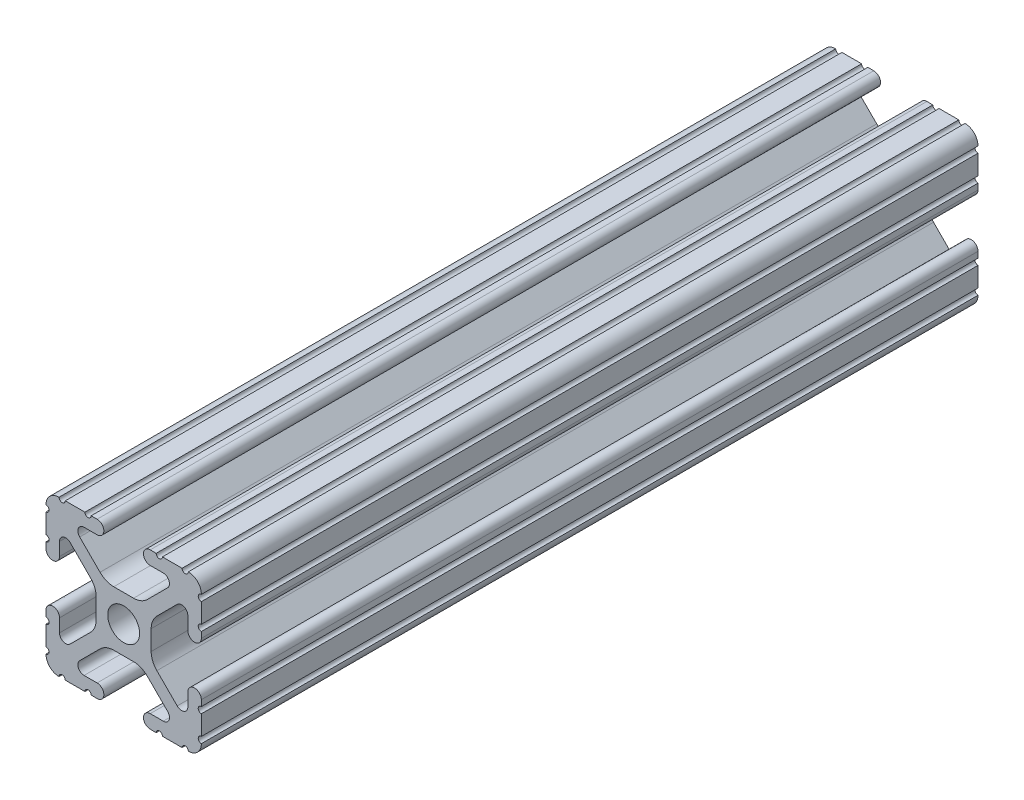
from build123d import *

# Parameters (mm, degrees)
SKETCH1_R           = 2.6035
BOSS_EXTRUDE1_DEPTH = 127


with BuildPart() as part:
    # Sketch1 → Boss-Extrude1 (new body)
    with BuildSketch(Plane.XY):
        with BuildLine():
            Line((-12.7, -6.3330836), (-12.7, -9.5504))
            ThreePointArc((-12.7, -9.5504), (-12.192000006, -10.058323491), (-12.699846982, -10.566399977))
            ThreePointArc((-12.699846982, -10.566399977), (-12.082522516, -12.082522516), (-10.566399977, -12.699846982))
            ThreePointArc((-10.566399977, -12.699846982), (-10.058323491, -12.192000006), (-9.5504, -12.7))
            Line((-9.5504, -12.7), (-6.3330836, -12.7))
            ThreePointArc((-6.3330836, -12.7), (-5.8250836, -12.192), (-5.3170836, -12.7))
            Line((-5.3170836, -12.7), (-4.343399971, -12.7))
            ThreePointArc((-4.343399971, -12.7), (-3.238499971, -11.5951), (-4.343399971, -10.4902))
            Line((-4.343399971, -10.4902), (-6.474794456, -10.4902))
            ThreePointArc((-6.474794456, -10.4902), (-7.413456061, -9.863006367), (-7.193214945, -8.75577951))
            Line((-7.193214945, -8.75577951), (-3.863171405, -5.42573597))
            ThreePointArc((-3.863171405, -5.42573597), (-2.833127272, -4.737482484), (-1.618107374, -4.4958))
            Line((-1.618107374, -4.4958), (1.618107374, -4.4958))
            ThreePointArc((1.618107374, -4.4958), (2.833127272, -4.737482484), (3.863171405, -5.42573597))
            Line((3.863171405, -5.42573597), (7.193214945, -8.75577951))
            ThreePointArc((7.193214945, -8.75577951), (7.413456061, -9.863006367), (6.474794456, -10.4902))
            Line((6.474794456, -10.4902), (4.3434, -10.4902))
            ThreePointArc((4.3434, -10.4902), (3.2385, -11.5951), (4.3434, -12.7))
            Line((4.3434, -12.7), (5.3170836, -12.7))
            ThreePointArc((5.3170836, -12.7), (5.8250836, -12.192), (6.3330836, -12.7))
            Line((6.3330836, -12.7), (9.5504, -12.7))
            ThreePointArc((9.5504, -12.7), (10.058323491, -12.192000006), (10.566399977, -12.699846982))
            ThreePointArc((10.566399977, -12.699846982), (12.082522516, -12.082522516), (12.699846982, -10.566399977))
            ThreePointArc((12.699846982, -10.566399977), (12.192000006, -10.058323491), (12.7, -9.5504))
            Line((12.7, -9.5504), (12.7, -6.3330836))
            ThreePointArc((12.7, -6.3330836), (12.192, -5.8250836), (12.7, -5.3170836))
            Line((12.7, -5.3170836), (12.7, -4.343399971))
            ThreePointArc((12.7, -4.343399971), (11.5951, -3.238499971), (10.4902, -4.343399971))
            Line((10.4902, -4.343399971), (10.4902, -6.474794456))
            ThreePointArc((10.4902, -6.474794456), (9.863006367, -7.413456061), (8.75577951, -7.193214945))
            Line((8.75577951, -7.193214945), (5.42573597, -3.863171405))
            ThreePointArc((5.42573597, -3.863171405), (4.737482484, -2.833127272), (4.4958, -1.618107374))
            Line((4.4958, -1.618107374), (4.4958, 1.618107374))
            ThreePointArc((4.4958, 1.618107374), (4.737482484, 2.833127272), (5.42573597, 3.863171405))
            Line((5.42573597, 3.863171405), (8.75577951, 7.193214945))
            ThreePointArc((8.75577951, 7.193214945), (9.863006367, 7.413456061), (10.4902, 6.474794456))
            Line((10.4902, 6.474794456), (10.4902, 4.3434))
            ThreePointArc((10.4902, 4.3434), (11.5951, 3.2385), (12.7, 4.3434))
            Line((12.7, 4.3434), (12.7, 5.3170836))
            ThreePointArc((12.7, 5.3170836), (12.192, 5.8250836), (12.7, 6.3330836))
            Line((12.7, 6.3330836), (12.7, 9.5504))
            ThreePointArc((12.7, 9.5504), (12.192000006, 10.058323491), (12.699846982, 10.566399977))
            ThreePointArc((12.699846982, 10.566399977), (12.082522516, 12.082522516), (10.566399977, 12.699846982))
            ThreePointArc((10.566399977, 12.699846982), (10.058323491, 12.192000006), (9.5504, 12.7))
            Line((9.5504, 12.7), (6.3330836, 12.7))
            ThreePointArc((6.3330836, 12.7), (5.8250836, 12.192), (5.3170836, 12.7))
            Line((5.3170836, 12.7), (4.343399971, 12.7))
            ThreePointArc((4.343399971, 12.7), (3.238499971, 11.5951), (4.343399971, 10.4902))
            Line((4.343399971, 10.4902), (6.474794456, 10.4902))
            ThreePointArc((6.474794456, 10.4902), (7.413456061, 9.863006367), (7.193214945, 8.75577951))
            Line((7.193214945, 8.75577951), (3.863171405, 5.42573597))
            ThreePointArc((3.863171405, 5.42573597), (2.833127272, 4.737482484), (1.618107374, 4.4958))
            Line((1.618107374, 4.4958), (-1.618107374, 4.4958))
            ThreePointArc((-1.618107374, 4.4958), (-2.833127272, 4.737482484), (-3.863171405, 5.42573597))
            Line((-3.863171405, 5.42573597), (-7.193214945, 8.75577951))
            ThreePointArc((-7.193214945, 8.75577951), (-7.413456061, 9.863006367), (-6.474794456, 10.4902))
            Line((-6.474794456, 10.4902), (-4.3434, 10.4902))
            ThreePointArc((-4.3434, 10.4902), (-3.2385, 11.5951), (-4.3434, 12.7))
            Line((-4.3434, 12.7), (-5.3170836, 12.7))
            ThreePointArc((-5.3170836, 12.7), (-5.8250836, 12.192), (-6.3330836, 12.7))
            Line((-6.3330836, 12.7), (-9.5504, 12.7))
            ThreePointArc((-9.5504, 12.7), (-10.058323491, 12.192000006), (-10.566399977, 12.699846982))
            ThreePointArc((-10.566399977, 12.699846982), (-12.082522516, 12.082522516), (-12.699846982, 10.566399977))
            ThreePointArc((-12.699846982, 10.566399977), (-12.192000006, 10.058323491), (-12.7, 9.5504))
            Line((-12.7, 9.5504), (-12.7, 6.3330836))
            ThreePointArc((-12.7, 6.3330836), (-12.192, 5.8250836), (-12.7, 5.3170836))
            Line((-12.7, 5.3170836), (-12.7, 4.343399971))
            ThreePointArc((-12.7, 4.343399971), (-11.5951, 3.238499971), (-10.4902, 4.343399971))
            Line((-10.4902, 4.343399971), (-10.4902, 6.474794456))
            ThreePointArc((-10.4902, 6.474794456), (-9.863006367, 7.413456061), (-8.75577951, 7.193214945))
            Line((-8.75577951, 7.193214945), (-5.42573597, 3.863171405))
            ThreePointArc((-5.42573597, 3.863171405), (-4.737482484, 2.833127272), (-4.4958, 1.618107374))
            Line((-4.4958, 1.618107374), (-4.4958, -1.618107374))
            ThreePointArc((-4.4958, -1.618107374), (-4.737482484, -2.833127272), (-5.42573597, -3.863171405))
            Line((-5.42573597, -3.863171405), (-8.75577951, -7.193214945))
            ThreePointArc((-8.75577951, -7.193214945), (-9.863006367, -7.413456061), (-10.4902, -6.474794456))
            Line((-10.4902, -6.474794456), (-10.4902, -4.3434))
            ThreePointArc((-10.4902, -4.3434), (-11.5951, -3.2385), (-12.7, -4.3434))
            Line((-12.7, -4.3434), (-12.7, -5.3170836))
            ThreePointArc((-12.7, -5.3170836), (-12.192, -5.8250836), (-12.7, -6.3330836))
        make_face()
        Circle(SKETCH1_R, mode=Mode.SUBTRACT)
    extrude(amount=-BOSS_EXTRUDE1_DEPTH)


solid = part.part
